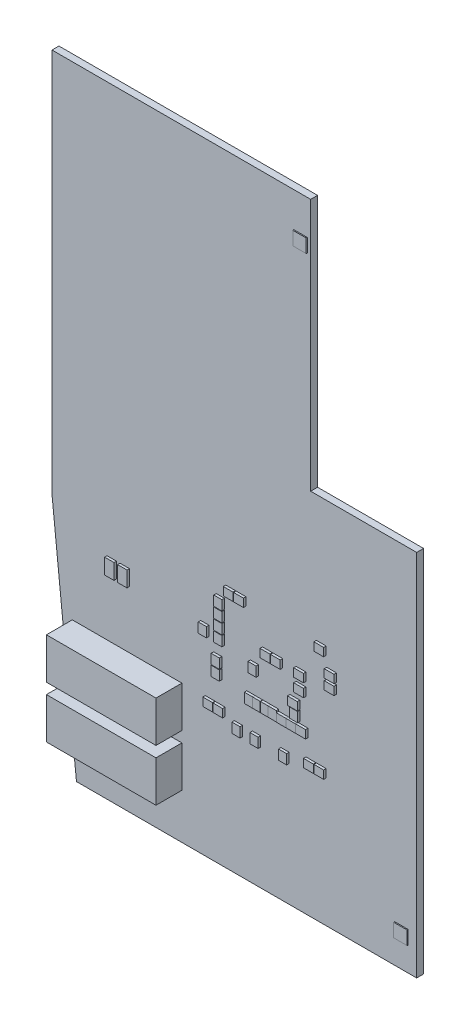
from build123d import *

# Parameters (mm, degrees)
BOARD_DEPTH                   = 1.697736
SKETCH2_W                     = 27.999944
SKETCH2_H                     = 27.999944
PBGA_324P_1MM_1_DEPTH         = 2.549906
SKETCH5_W                     = 7.20344
SKETCH5_H                     = 10.203434
SOT_223_1_DEPTH               = 1.778
SKETCH8_W                     = 12.003278
SKETCH8_H                     = 11.703304
HTSSOP_32P_0_65_1_DEPTH       = 2.649982
SKETCH53_W                    = 8.203184
SKETCH53_H                    = 5.803138
TSSOP_14P_0_65_1_DEPTH        = 1.100074
SKETCH54_W                    = 8.203184
SKETCH54_H                    = 5.803138
TSSOP_14P_0_65_2_DEPTH        = 1.100074
SKETCH57_W                    = 11.699748
SKETCH57_H                    = 9.699752
BGA_48P_0_8_1_DEPTH           = 0.999998
SKETCH58_W                    = 11.699748
SKETCH58_H                    = 9.699752
FBGA_48P_0_75_S_1_DEPTH       = 1.199896
SKETCH59_W                    = 13.700252
SKETCH59_H                    = 13.700252
FBGA_48P_0_75_1_DEPTH         = 1.35001
SKETCH60_W                    = 13.999972
SKETCH60_H                    = 13.999972
TFBGA_128P_0_8_1_DEPTH        = 1.199896
SKETCH62_W                    = 5.84327
SKETCH62_H                    = 8.279384
SO8_1_DEPTH                   = 1.75006
SKETCH66_W                    = 15.003272
SKETCH66_H                    = 14.203172
TQFP_44P_0_8_1_DEPTH          = 1.199896
SKETCH68_W                    = 5.84327
SKETCH68_H                    = 8.279384
SO8_2_DEPTH                   = 1.75006
SKETCH79_W                    = 13.999972
SKETCH79_H                    = 13.999972
TFBGA_128P_0_8_2_DEPTH        = 1.199896
SKETCH106_W                   = 8.279384
SKETCH106_H                   = 5.84327
SO8_3_DEPTH                   = 1.75006
SKETCH140_W                   = 3.854196
SKETCH140_H                   = 8.970264
TSSOP_8P_0_65_1_DEPTH         = 1.199896
SKETCH150_W                   = 7.403338
SKETCH150_H                   = 8.453374
TSSOP_20_0_65_1_DEPTH         = 1.199896
SKETCH151_W                   = 3.70332
SKETCH151_H                   = 6.703314
MSOP_10P_0_5_1_DEPTH          = 1.100074
SKETCH164_W                   = 42.203116
SKETCH164_H                   = 9.003284
CON_80P_0_8MM_QSE_SOC_1_DEPTH = 3.048
SKETCH165_W                   = 42.203116
SKETCH165_H                   = 9.003284
CON_80P_0_8MM_QSE_SOC_2_DEPTH = 3.048
CON_10P_100_RA_1_DEPTH        = 4.826
SKETCH171_W                   = 14.1732
SKETCH171_H                   = 19.8882
CON_14P_100_RA_1_DEPTH        = 4.826
SKETCH172_W                   = 14.203172
SKETCH172_H                   = 7.703312
DPAK_1_DEPTH                  = 2.54
SKETCH173_W                   = 7.703312
SKETCH173_H                   = 14.203172
DPAK_2_DEPTH                  = 2.54
SKETCH174_W                   = 6.453378
SKETCH174_H                   = 3.753358
MSOP_8P_0_65_1_DEPTH          = 1.100074
SKETCH175_W                   = 6.453378
SKETCH175_H                   = 3.753358
MSOP_8P_0_65_2_DEPTH          = 1.100074
SKETCH176_W                   = 6.453378
SKETCH176_H                   = 3.753358
MSOP_8P_0_65_3_DEPTH          = 1.100074
SKETCH177_W                   = 6.453378
SKETCH177_H                   = 3.753358
MSOP_8P_0_65_4_DEPTH          = 1.100074
SKETCH179_W                   = 8.279384
SKETCH179_H                   = 5.84327
SO8_4_DEPTH                   = 1.75006
SKETCH180_W                   = 2.303272
SKETCH180_H                   = 3.803396
SOT_553_5P_1_DEPTH            = 0.599948
SKETCH181_W                   = 2.303272
SKETCH181_H                   = 3.803396
SOT_553_5P_2_DEPTH            = 0.599948
SKETCH192_W                   = 4.903216
SKETCH192_H                   = 3.05308
RP_0402_16P_1_DEPTH           = 0.54991
SKETCH193_W                   = 4.903216
SKETCH193_H                   = 3.05308
RP_0402_16P_2_DEPTH           = 0.54991
SKETCH194_W                   = 3.05308
SKETCH194_H                   = 4.903216
RP_0402_16P_3_DEPTH           = 0.54991
SKETCH195_W                   = 3.05308
SKETCH195_H                   = 4.903216
RP_0402_16P_4_DEPTH           = 0.54991
SKETCH196_W                   = 3.05308
SKETCH196_H                   = 4.903216
RP_0402_16P_5_DEPTH           = 0.54991
SKETCH200_W                   = 7.403338
SKETCH200_H                   = 8.453374
TSSOP_20_0_65_2_DEPTH         = 1.199896
SKETCH201_W                   = 7.403338
SKETCH201_H                   = 8.453374
TSSOP_20_0_65_3_DEPTH         = 1.199896
SKETCH202_W                   = 7.403338
SKETCH202_H                   = 8.453374
TSSOP_20_0_65_4_DEPTH         = 1.199896
SKETCH203_W                   = 7.403338
SKETCH203_H                   = 8.453374
TSSOP_20_0_65_5_DEPTH         = 1.199896
SKETCH333_W                   = 2.003044
SKETCH333_H                   = 2.403348
EXTRUDE_C0306_1_DEPTH         = 0.610108
SKETCH334_W                   = 2.403348
SKETCH334_H                   = 2.003044
EXTRUDE_C0306_2_DEPTH         = 0.610108
SKETCH335_W                   = 2.403348
SKETCH335_H                   = 2.003044
EXTRUDE_C0306_3_DEPTH         = 0.610108
SKETCH336_W                   = 2.003044
SKETCH336_H                   = 2.403348
EXTRUDE_C0306_4_DEPTH         = 0.610108
SKETCH337_W                   = 2.003044
SKETCH337_H                   = 2.403348
EXTRUDE_C0306_5_DEPTH         = 0.610108
SKETCH338_W                   = 2.003044
SKETCH338_H                   = 2.403348
EXTRUDE_C0306_6_DEPTH         = 0.610108
SKETCH339_W                   = 2.003044
SKETCH339_H                   = 2.403348
EXTRUDE_C0306_7_DEPTH         = 0.610108
SKETCH340_W                   = 2.403348
SKETCH340_H                   = 2.003044
EXTRUDE_C0306_8_DEPTH         = 0.610108
SKETCH341_W                   = 2.403348
SKETCH341_H                   = 2.003044
EXTRUDE_C0306_9_DEPTH         = 0.610108
SKETCH342_W                   = 2.403348
SKETCH342_H                   = 2.003044
EXTRUDE_C0306_10_DEPTH        = 0.610108
SKETCH343_W                   = 2.003044
SKETCH343_H                   = 2.403348
EXTRUDE_C0306_11_DEPTH        = 0.610108
SKETCH344_W                   = 2.003044
SKETCH344_H                   = 2.403348
EXTRUDE_C0306_12_DEPTH        = 0.610108
SKETCH345_W                   = 2.403348
SKETCH345_H                   = 2.003044
EXTRUDE_C0306_13_DEPTH        = 0.610108
SKETCH346_W                   = 2.003044
SKETCH346_H                   = 2.403348
EXTRUDE_C0306_14_DEPTH        = 0.610108
SKETCH347_W                   = 2.003044
SKETCH347_H                   = 2.403348
EXTRUDE_C0306_15_DEPTH        = 0.610108
SKETCH348_W                   = 2.003044
SKETCH348_H                   = 2.403348
EXTRUDE_C0306_16_DEPTH        = 0.610108
SKETCH349_W                   = 2.403348
SKETCH349_H                   = 2.003044
EXTRUDE_C0306_17_DEPTH        = 0.610108
SKETCH350_W                   = 2.403348
SKETCH350_H                   = 2.003044
EXTRUDE_C0306_18_DEPTH        = 0.610108
SKETCH351_W                   = 2.403348
SKETCH351_H                   = 2.003044
EXTRUDE_C0306_19_DEPTH        = 0.610108
SKETCH352_W                   = 2.003044
SKETCH352_H                   = 2.403348
EXTRUDE_C0306_20_DEPTH        = 0.610108
SKETCH353_W                   = 2.403348
SKETCH353_H                   = 2.003044
EXTRUDE_C0306_21_DEPTH        = 0.610108
SKETCH354_W                   = 2.003044
SKETCH354_H                   = 2.403348
EXTRUDE_C0306_22_DEPTH        = 0.610108
SKETCH355_W                   = 2.403348
SKETCH355_H                   = 2.003044
EXTRUDE_C0306_23_DEPTH        = 0.610108
SKETCH356_W                   = 2.403348
SKETCH356_H                   = 2.003044
EXTRUDE_C0306_24_DEPTH        = 0.610108
SKETCH357_W                   = 2.403348
SKETCH357_H                   = 2.003044
EXTRUDE_C0306_25_DEPTH        = 0.610108
SKETCH358_W                   = 2.403348
SKETCH358_H                   = 2.003044
EXTRUDE_C0306_26_DEPTH        = 0.610108
SKETCH359_W                   = 2.403348
SKETCH359_H                   = 2.003044
EXTRUDE_C0306_27_DEPTH        = 0.610108
SKETCH360_W                   = 2.403348
SKETCH360_H                   = 2.003044
EXTRUDE_C0306_28_DEPTH        = 0.610108
SKETCH361_W                   = 2.403348
SKETCH361_H                   = 2.003044
EXTRUDE_C0306_29_DEPTH        = 0.610108
SKETCH362_W                   = 2.003044
SKETCH362_H                   = 2.403348
EXTRUDE_C0306_30_DEPTH        = 0.610108
SKETCH363_W                   = 2.003044
SKETCH363_H                   = 2.403348
EXTRUDE_C0306_31_DEPTH        = 0.610108
SKETCH364_W                   = 2.003044
SKETCH364_H                   = 2.403348
EXTRUDE_C0306_32_DEPTH        = 0.610108
SKETCH365_W                   = 2.003044
SKETCH365_H                   = 2.403348
EXTRUDE_C0306_33_DEPTH        = 0.610108
SKETCH407_W                   = 8.279384
SKETCH407_H                   = 5.84327
SO8_5_DEPTH                   = 1.75006
CON_6P_100_RA_1_DEPTH         = 4.1148
SKETCH419_W                   = 26.8732
SKETCH419_H                   = 10.0711
CON_38P_25_TE_1_DEPTH         = 6.35
SKETCH420_W                   = 26.8732
SKETCH420_H                   = 10.0711
CON_38P_25_TE_2_DEPTH         = 6.35
SKETCH443_W                   = 3.302
SKETCH443_H                   = 3.302
FIDUCIAL_1_DEPTH              = 0.254
SKETCH444_W                   = 3.302
SKETCH444_H                   = 3.302
FIDUCIAL_2_DEPTH              = 0.254
SKETCH445_W                   = 3.302
SKETCH445_H                   = 3.302
FIDUCIAL_3_DEPTH              = 0.254
SKETCH446_W                   = 3.302
SKETCH446_H                   = 3.302
FIDUCIAL_4_DEPTH              = 0.254
SKETCH447_W                   = 3.302
SKETCH447_H                   = 3.302
FIDUCIAL_5_DEPTH              = 0.254
SKETCH448_W                   = 3.302
SKETCH448_H                   = 3.302
FIDUCIAL_6_DEPTH              = 0.254


with BuildPart() as part:
    # Sketch1 → BOARD (new body)
    with BuildSketch(Plane.XY):
        Polygon((0, 152.4), (0, 57.999884), (5.999988, 0), (89.440004, 0), (89.440004, 90.400124), (63.440056, 90.400124), (63.440056, 152.4), align=None)
    extrude(amount=BOARD_DEPTH)


with BuildPart() as body_2:
    # Sketch2 → PBGA_324P_1MM-1 (new body)
    with BuildSketch(Plane.XY):
        with Locations((54.99989, 44.99991)):
            Rectangle(SKETCH2_W, SKETCH2_H)
    extrude(amount=-PBGA_324P_1MM_1_DEPTH)


with BuildPart() as body_3:
    # Sketch5 → SOT-223-1 (new body)
    with BuildSketch(Plane.XY):
        with Locations((78.74, 69.731001)):
            Rectangle(SKETCH5_W, SKETCH5_H)
    extrude(amount=-SOT_223_1_DEPTH)


with BuildPart() as body_4:
    # Sketch8 → HTSSOP_32P_0_65-1 (new body)
    with BuildSketch(Plane.XY):
        with Locations((38.100127, 131.500118)):
            Rectangle(SKETCH8_W, SKETCH8_H)
    extrude(amount=-HTSSOP_32P_0_65_1_DEPTH)


with BuildPart() as body_5:
    # Sketch53 → TSSOP_14P_0_65-1 (new body)
    with BuildSketch(Plane.XY):
        with Locations((29.595064, 38.050089)):
            Rectangle(SKETCH53_W, SKETCH53_H)
    extrude(amount=-TSSOP_14P_0_65_1_DEPTH)


with BuildPart() as body_6:
    # Sketch54 → TSSOP_14P_0_65-2 (new body)
    with BuildSketch(Plane.XY):
        with Locations((29.595064, 27.255089)):
            Rectangle(SKETCH54_W, SKETCH54_H)
    extrude(amount=-TSSOP_14P_0_65_2_DEPTH)


with BuildPart() as body_7:
    # Sketch57 → BGA_48P_0_8-1 (new body)
    with BuildSketch(Plane.XY):
        with Locations((81.000092, 17.999964)):
            Rectangle(SKETCH57_W, SKETCH57_H)
    extrude(amount=-BGA_48P_0_8_1_DEPTH)


with BuildPart() as body_8:
    # Sketch58 → FBGA_48P_0_75_S-1 (new body)
    with BuildSketch(Plane.XY):
        with Locations((81.000092, 44.99991)):
            Rectangle(SKETCH58_W, SKETCH58_H)
    extrude(amount=-FBGA_48P_0_75_S_1_DEPTH)


with BuildPart() as body_9:
    # Sketch59 → FBGA_48P_0_75-1 (new body)
    with BuildSketch(Plane.XY):
        with Locations((81.000092, 31.999936)):
            Rectangle(SKETCH59_W, SKETCH59_H)
    extrude(amount=-FBGA_48P_0_75_1_DEPTH)


with BuildPart() as body_10:
    # Sketch60 → TFBGA_128P_0_8-1 (new body)
    with BuildSketch(Plane.XY):
        with Locations((28.999942, 77.0001)):
            Rectangle(SKETCH60_W, SKETCH60_H)
    extrude(amount=-TFBGA_128P_0_8_1_DEPTH)


with BuildPart() as body_11:
    # Sketch62 → SO8-1 (new body)
    with BuildSketch(Plane.XY):
        with Locations((5.995035, 93.497908)):
            Rectangle(SKETCH62_W, SKETCH62_H)
    extrude(amount=-SO8_1_DEPTH)


with BuildPart() as body_12:
    # Sketch66 → TQFP_44P_0_8-1 (new body)
    with BuildSketch(Plane.XY):
        with Locations((24.53005, 56.515)):
            Rectangle(SKETCH66_W, SKETCH66_H)
    extrude(amount=-TQFP_44P_0_8_1_DEPTH)


with BuildPart() as body_13:
    # Sketch68 → SO8-2 (new body)
    with BuildSketch(Plane.XY):
        with Locations((56.869965, 94.462092)):
            Rectangle(SKETCH68_W, SKETCH68_H)
    extrude(amount=-SO8_2_DEPTH)


with BuildPart() as body_14:
    # Sketch79 → TFBGA_128P_0_8-2 (new body)
    with BuildSketch(Plane.XY):
        with Locations((50.999898, 77.0001)):
            Rectangle(SKETCH79_W, SKETCH79_H)
    extrude(amount=-TFBGA_128P_0_8_2_DEPTH)


with BuildPart() as body_15:
    # Sketch106 → SO8-3 (new body)
    with BuildSketch(Plane.XY):
        with Locations((33.982152, 108.779945)):
            Rectangle(SKETCH106_W, SKETCH106_H)
    extrude(amount=-SO8_3_DEPTH)


with BuildPart() as body_16:
    # Sketch140 → TSSOP_8P_0_65-1 (new body)
    with BuildSketch(Plane.XY):
        with Locations((34.059876, 53.05679)):
            Rectangle(SKETCH140_W, SKETCH140_H)
    extrude(amount=-TSSOP_8P_0_65_1_DEPTH)


with BuildPart() as body_17:
    # Sketch150 → TSSOP_20_0_65-1 (new body)
    with BuildSketch(Plane.XY):
        with Locations((70.385051, 8.630031)):
            Rectangle(SKETCH150_W, SKETCH150_H)
    extrude(amount=-TSSOP_20_0_65_1_DEPTH)


with BuildPart() as body_18:
    # Sketch151 → MSOP_10P_0_5-1 (new body)
    with BuildSketch(Plane.XY):
        with Locations((27.305, 16.259937)):
            Rectangle(SKETCH151_W, SKETCH151_H)
    extrude(amount=-MSOP_10P_0_5_1_DEPTH)


with BuildPart() as body_19:
    # Sketch164 → CON_80P_0_8MM_QSE_SOC-1 (new body)
    with BuildSketch(Plane.XY):
        with Locations((31.640018, 94.819978)):
            Rectangle(SKETCH164_W, SKETCH164_H)
    extrude(amount=-CON_80P_0_8MM_QSE_SOC_1_DEPTH)


with BuildPart() as body_20:
    # Sketch165 → CON_80P_0_8MM_QSE_SOC-2 (new body)
    with BuildSketch(Plane.XY):
        with Locations((43.720004, 6.700012)):
            Rectangle(SKETCH165_W, SKETCH165_H)
    extrude(amount=-CON_80P_0_8MM_QSE_SOC_2_DEPTH)


with BuildPart() as body_21:
    # Sketch170 → CON_10P_100_RA-1 (new body)
    with BuildSketch(Plane.XY):
        Polygon((0.698370082, 51.257474946), (-0.290302372, 65.396149743), (13.848372426, 66.384822197), (14.837044879, 52.246147399), align=None)
    extrude(amount=-CON_10P_100_RA_1_DEPTH)


with BuildPart() as body_22:
    # Sketch171 → CON_14P_100_RA-1 (new body)
    with BuildSketch(Plane.XY):
        with Locations((6.985, 77.7875)):
            Rectangle(SKETCH171_W, SKETCH171_H)
    extrude(amount=-CON_14P_100_RA_1_DEPTH)


with BuildPart() as body_23:
    # Sketch172 → DPAK-1 (new body)
    with BuildSketch(Plane.XY):
        with Locations((43.749976, 120.000014)):
            Rectangle(SKETCH172_W, SKETCH172_H)
    extrude(amount=-DPAK_1_DEPTH)


with BuildPart() as body_24:
    # Sketch173 → DPAK-2 (new body)
    with BuildSketch(Plane.XY):
        with Locations((21.500084, 133.75005)):
            Rectangle(SKETCH173_W, SKETCH173_H)
    extrude(amount=-DPAK_2_DEPTH)


with BuildPart() as body_25:
    # Sketch174 → MSOP_8P_0_65-1 (new body)
    with BuildSketch(Plane.XY):
        with Locations((82.874993, 80.035019)):
            Rectangle(SKETCH174_W, SKETCH174_H)
    extrude(amount=-MSOP_8P_0_65_1_DEPTH)


with BuildPart() as body_26:
    # Sketch175 → MSOP_8P_0_65-2 (new body)
    with BuildSketch(Plane.XY):
        with Locations((82.874993, 85.115019)):
            Rectangle(SKETCH175_W, SKETCH175_H)
    extrude(amount=-MSOP_8P_0_65_2_DEPTH)


with BuildPart() as body_27:
    # Sketch176 → MSOP_8P_0_65-3 (new body)
    with BuildSketch(Plane.XY):
        with Locations((71.444993, 80.035019)):
            Rectangle(SKETCH176_W, SKETCH176_H)
    extrude(amount=-MSOP_8P_0_65_3_DEPTH)


with BuildPart() as body_28:
    # Sketch177 → MSOP_8P_0_65-4 (new body)
    with BuildSketch(Plane.XY):
        with Locations((71.444993, 85.115019)):
            Rectangle(SKETCH177_W, SKETCH177_H)
    extrude(amount=-MSOP_8P_0_65_4_DEPTH)


with BuildPart() as body_29:
    # Sketch179 → SO8-4 (new body)
    with BuildSketch(Plane.XY):
        with Locations((4.977892, 135.449945)):
            Rectangle(SKETCH179_W, SKETCH179_H)
    extrude(amount=-SO8_4_DEPTH)


with BuildPart() as body_30:
    # Sketch180 → SOT_553_5P-1 (new body)
    with BuildSketch(Plane.XY.offset(1.697736)):
        with Locations((14.655038, 49.829974)):
            Rectangle(SKETCH180_W, SKETCH180_H)
    extrude(amount=SOT_553_5P_1_DEPTH)


with BuildPart() as body_31:
    # Sketch181 → SOT_553_5P-2 (new body)
    with BuildSketch(Plane.XY.offset(1.697736)):
        with Locations((17.830038, 49.829974)):
            Rectangle(SKETCH181_W, SKETCH181_H)
    extrude(amount=SOT_553_5P_2_DEPTH)


with BuildPart() as body_32:
    # Sketch192 → RP_0402_16P-1 (new body)
    with BuildSketch(Plane.XY):
        with Locations((66.675, 28.984956)):
            Rectangle(SKETCH192_W, SKETCH192_H)
    extrude(amount=-RP_0402_16P_1_DEPTH)


with BuildPart() as body_33:
    # Sketch193 → RP_0402_16P-2 (new body)
    with BuildSketch(Plane.XY):
        with Locations((61.595, 28.730956)):
            Rectangle(SKETCH193_W, SKETCH193_H)
    extrude(amount=-RP_0402_16P_2_DEPTH)


with BuildPart() as body_34:
    # Sketch194 → RP_0402_16P-3 (new body)
    with BuildSketch(Plane.XY):
        with Locations((71.980044, 42.545)):
            Rectangle(SKETCH194_W, SKETCH194_H)
    extrude(amount=-RP_0402_16P_3_DEPTH)


with BuildPart() as body_35:
    # Sketch195 → RP_0402_16P-4 (new body)
    with BuildSketch(Plane.XY):
        with Locations((71.980044, 37.465)):
            Rectangle(SKETCH195_W, SKETCH195_H)
    extrude(amount=-RP_0402_16P_4_DEPTH)


with BuildPart() as body_36:
    # Sketch196 → RP_0402_16P-5 (new body)
    with BuildSketch(Plane.XY):
        with Locations((71.980044, 47.625)):
            Rectangle(SKETCH196_W, SKETCH196_H)
    extrude(amount=-RP_0402_16P_5_DEPTH)


with BuildPart() as body_37:
    # Sketch200 → TSSOP_20_0_65-2 (new body)
    with BuildSketch(Plane.XY):
        with Locations((36.730051, 18.790031)):
            Rectangle(SKETCH200_W, SKETCH200_H)
    extrude(amount=-TSSOP_20_0_65_2_DEPTH)


with BuildPart() as body_38:
    # Sketch201 → TSSOP_20_0_65-3 (new body)
    with BuildSketch(Plane.XY):
        with Locations((53.240051, 18.790031)):
            Rectangle(SKETCH201_W, SKETCH201_H)
    extrude(amount=-TSSOP_20_0_65_3_DEPTH)


with BuildPart() as body_39:
    # Sketch202 → TSSOP_20_0_65-4 (new body)
    with BuildSketch(Plane.XY):
        with Locations((44.985051, 18.790031)):
            Rectangle(SKETCH202_W, SKETCH202_H)
    extrude(amount=-TSSOP_20_0_65_4_DEPTH)


with BuildPart() as body_40:
    # Sketch203 → TSSOP_20_0_65-5 (new body)
    with BuildSketch(Plane.XY):
        with Locations((61.495051, 18.790031)):
            Rectangle(SKETCH203_W, SKETCH203_H)
    extrude(amount=-TSSOP_20_0_65_5_DEPTH)


with BuildPart() as body_41:
    # Sketch333 → C0306-1 (new body)
    with BuildSketch(Plane.XY.offset(1.697736)):
        with Locations((49.657, 45.974)):
            Rectangle(SKETCH333_W, SKETCH333_H)
    extrude(amount=EXTRUDE_C0306_1_DEPTH)


with BuildPart() as body_42:
    # Sketch334 → C0306-2 (new body)
    with BuildSketch(Plane.XY.offset(1.697736)):
        with Locations((68.58, 51.435)):
            Rectangle(SKETCH334_W, SKETCH334_H)
    extrude(amount=EXTRUDE_C0306_2_DEPTH)


with BuildPart() as body_43:
    # Sketch335 → C0306-3 (new body)
    with BuildSketch(Plane.XY.offset(1.697736)):
        with Locations((59.563, 43.688)):
            Rectangle(SKETCH335_W, SKETCH335_H)
    extrude(amount=EXTRUDE_C0306_3_DEPTH)


with BuildPart() as body_44:
    # Sketch336 → C0306-4 (new body)
    with BuildSketch(Plane.XY.offset(1.697736)):
        with Locations((54.61, 38.989)):
            Rectangle(SKETCH336_W, SKETCH336_H)
    extrude(amount=EXTRUDE_C0306_4_DEPTH)


with BuildPart() as body_45:
    # Sketch337 → C0306-5 (new body)
    with BuildSketch(Plane.XY.offset(1.697736)):
        with Locations((50.673, 38.989)):
            Rectangle(SKETCH337_W, SKETCH337_H)
    extrude(amount=EXTRUDE_C0306_5_DEPTH)


with BuildPart() as body_46:
    # Sketch338 → C0306-6 (new body)
    with BuildSketch(Plane.XY.offset(1.697736)):
        with Locations((48.768, 38.989)):
            Rectangle(SKETCH338_W, SKETCH338_H)
    extrude(amount=EXTRUDE_C0306_6_DEPTH)


with BuildPart() as body_47:
    # Sketch339 → C0306-7 (new body)
    with BuildSketch(Plane.XY.offset(1.697736)):
        with Locations((59.817, 41.402)):
            Rectangle(SKETCH339_W, SKETCH339_H)
    extrude(amount=EXTRUDE_C0306_7_DEPTH)


with BuildPart() as body_48:
    # Sketch340 → C0306-8 (new body)
    with BuildSketch(Plane.XY.offset(1.697736)):
        with Locations((59.182, 38.735)):
            Rectangle(SKETCH340_W, SKETCH340_H)
    extrude(amount=EXTRUDE_C0306_8_DEPTH)


with BuildPart() as body_49:
    # Sketch341 → C0306-9 (new body)
    with BuildSketch(Plane.XY.offset(1.697736)):
        with Locations((56.769, 38.735)):
            Rectangle(SKETCH341_W, SKETCH341_H)
    extrude(amount=EXTRUDE_C0306_9_DEPTH)


with BuildPart() as body_50:
    # Sketch342 → C0306-10 (new body)
    with BuildSketch(Plane.XY.offset(1.697736)):
        with Locations((43.815, 59.055)):
            Rectangle(SKETCH342_W, SKETCH342_H)
    extrude(amount=EXTRUDE_C0306_10_DEPTH)


with BuildPart() as body_51:
    # Sketch343 → C0306-11 (new body)
    with BuildSketch(Plane.XY.offset(1.697736)):
        with Locations((41.275, 50.8)):
            Rectangle(SKETCH343_W, SKETCH343_H)
    extrude(amount=EXTRUDE_C0306_11_DEPTH)


with BuildPart() as body_52:
    # Sketch344 → C0306-12 (new body)
    with BuildSketch(Plane.XY.offset(1.697736)):
        with Locations((41.275, 55.88)):
            Rectangle(SKETCH344_W, SKETCH344_H)
    extrude(amount=EXTRUDE_C0306_12_DEPTH)


with BuildPart() as body_53:
    # Sketch345 → C0306-13 (new body)
    with BuildSketch(Plane.XY.offset(1.697736)):
        with Locations((68.58, 53.975)):
            Rectangle(SKETCH345_W, SKETCH345_H)
    extrude(amount=EXTRUDE_C0306_13_DEPTH)


with BuildPart() as body_54:
    # Sketch346 → C0306-14 (new body)
    with BuildSketch(Plane.XY.offset(1.697736)):
        with Locations((57.15, 31.115)):
            Rectangle(SKETCH346_W, SKETCH346_H)
    extrude(amount=EXTRUDE_C0306_14_DEPTH)


with BuildPart() as body_55:
    # Sketch347 → C0306-15 (new body)
    with BuildSketch(Plane.XY.offset(1.697736)):
        with Locations((40.64, 40.64)):
            Rectangle(SKETCH347_W, SKETCH347_H)
    extrude(amount=EXTRUDE_C0306_15_DEPTH)


with BuildPart() as body_56:
    # Sketch348 → C0306-16 (new body)
    with BuildSketch(Plane.XY.offset(1.697736)):
        with Locations((45.72, 31.115)):
            Rectangle(SKETCH348_W, SKETCH348_H)
    extrude(amount=EXTRUDE_C0306_16_DEPTH)


with BuildPart() as body_57:
    # Sketch349 → C0306-17 (new body)
    with BuildSketch(Plane.XY.offset(1.697736)):
        with Locations((63.5, 32.385)):
            Rectangle(SKETCH349_W, SKETCH349_H)
    extrude(amount=EXTRUDE_C0306_17_DEPTH)


with BuildPart() as body_58:
    # Sketch350 → C0306-18 (new body)
    with BuildSketch(Plane.XY.offset(1.697736)):
        with Locations((52.832, 50.419)):
            Rectangle(SKETCH350_W, SKETCH350_H)
    extrude(amount=EXTRUDE_C0306_18_DEPTH)


with BuildPart() as body_59:
    # Sketch351 → C0306-19 (new body)
    with BuildSketch(Plane.XY.offset(1.697736)):
        with Locations((55.372, 50.419)):
            Rectangle(SKETCH351_W, SKETCH351_H)
    extrude(amount=EXTRUDE_C0306_19_DEPTH)


with BuildPart() as body_60:
    # Sketch352 → C0306-20 (new body)
    with BuildSketch(Plane.XY.offset(1.697736)):
        with Locations((37.465, 48.26)):
            Rectangle(SKETCH352_W, SKETCH352_H)
    extrude(amount=EXTRUDE_C0306_20_DEPTH)


with BuildPart() as body_61:
    # Sketch353 → C0306-21 (new body)
    with BuildSketch(Plane.XY.offset(1.697736)):
        with Locations((66.04, 58.42)):
            Rectangle(SKETCH353_W, SKETCH353_H)
    extrude(amount=EXTRUDE_C0306_21_DEPTH)


with BuildPart() as body_62:
    # Sketch354 → C0306-22 (new body)
    with BuildSketch(Plane.XY.offset(1.697736)):
        with Locations((41.275, 53.34)):
            Rectangle(SKETCH354_W, SKETCH354_H)
    extrude(amount=EXTRUDE_C0306_22_DEPTH)


with BuildPart() as body_63:
    # Sketch355 → C0306-23 (new body)
    with BuildSketch(Plane.XY.offset(1.697736)):
        with Locations((46.355, 59.055)):
            Rectangle(SKETCH355_W, SKETCH355_H)
    extrude(amount=EXTRUDE_C0306_23_DEPTH)


with BuildPart() as body_64:
    # Sketch356 → C0306-24 (new body)
    with BuildSketch(Plane.XY.offset(1.697736)):
        with Locations((61.087, 50.419)):
            Rectangle(SKETCH356_W, SKETCH356_H)
    extrude(amount=EXTRUDE_C0306_24_DEPTH)


with BuildPart() as body_65:
    # Sketch357 → C0306-25 (new body)
    with BuildSketch(Plane.XY.offset(1.697736)):
        with Locations((38.7858, 33.0708)):
            Rectangle(SKETCH357_W, SKETCH357_H)
    extrude(amount=EXTRUDE_C0306_25_DEPTH)


with BuildPart() as body_66:
    # Sketch358 → C0306-26 (new body)
    with BuildSketch(Plane.XY.offset(1.697736)):
        with Locations((41.2496, 33.0454)):
            Rectangle(SKETCH358_W, SKETCH358_H)
    extrude(amount=EXTRUDE_C0306_26_DEPTH)


with BuildPart() as body_67:
    # Sketch359 → C0306-27 (new body)
    with BuildSketch(Plane.XY.offset(1.697736)):
        with Locations((66.04, 32.385)):
            Rectangle(SKETCH359_W, SKETCH359_H)
    extrude(amount=EXTRUDE_C0306_27_DEPTH)


with BuildPart() as body_68:
    # Sketch360 → C0306-28 (new body)
    with BuildSketch(Plane.XY.offset(1.697736)):
        with Locations((61.595, 38.735)):
            Rectangle(SKETCH360_W, SKETCH360_H)
    extrude(amount=EXTRUDE_C0306_28_DEPTH)


with BuildPart() as body_69:
    # Sketch361 → C0306-29 (new body)
    with BuildSketch(Plane.XY.offset(1.697736)):
        with Locations((61.087, 47.244)):
            Rectangle(SKETCH361_W, SKETCH361_H)
    extrude(amount=EXTRUDE_C0306_29_DEPTH)


with BuildPart() as body_70:
    # Sketch362 → C0306-30 (new body)
    with BuildSketch(Plane.XY.offset(1.697736)):
        with Locations((40.64, 43.18)):
            Rectangle(SKETCH362_W, SKETCH362_H)
    extrude(amount=EXTRUDE_C0306_30_DEPTH)


with BuildPart() as body_71:
    # Sketch363 → C0306-31 (new body)
    with BuildSketch(Plane.XY.offset(1.697736)):
        with Locations((50.165, 31.115)):
            Rectangle(SKETCH363_W, SKETCH363_H)
    extrude(amount=EXTRUDE_C0306_31_DEPTH)


with BuildPart() as body_72:
    # Sketch364 → C0306-32 (new body)
    with BuildSketch(Plane.XY.offset(1.697736)):
        with Locations((52.705, 38.989)):
            Rectangle(SKETCH364_W, SKETCH364_H)
    extrude(amount=EXTRUDE_C0306_32_DEPTH)


with BuildPart() as body_73:
    # Sketch365 → C0306-33 (new body)
    with BuildSketch(Plane.XY.offset(1.697736)):
        with Locations((41.275, 48.26)):
            Rectangle(SKETCH365_W, SKETCH365_H)
    extrude(amount=EXTRUDE_C0306_33_DEPTH)


with BuildPart() as body_74:
    # Sketch407 → SO8-5 (new body)
    with BuildSketch(Plane.XY):
        with Locations((18.897092, 44.730035)):
            Rectangle(SKETCH407_W, SKETCH407_H)
    extrude(amount=-SO8_5_DEPTH)


with BuildPart() as body_75:
    # Sketch418 → CON_6P_100_RA-1 (new body)
    with BuildSketch(Plane.XY):
        Polygon((2.634506762, 33.824660064), (1.020252798, 49.183260598), (13.852767719, 50.532012266), (15.467021683, 35.173411731), align=None)
    extrude(amount=-CON_6P_100_RA_1_DEPTH)


with BuildPart() as body_76:
    # Sketch419 → CON_38P_25_TE-1 (new body)
    with BuildSketch(Plane.XY.offset(1.697736)):
        with Locations((18.415, 28.80995)):
            Rectangle(SKETCH419_W, SKETCH419_H)
    extrude(amount=CON_38P_25_TE_1_DEPTH)


with BuildPart() as body_77:
    # Sketch420 → CON_38P_25_TE-2 (new body)
    with BuildSketch(Plane.XY.offset(1.697736)):
        with Locations((18.415, 16.10995)):
            Rectangle(SKETCH420_W, SKETCH420_H)
    extrude(amount=CON_38P_25_TE_2_DEPTH)


with BuildPart() as body_78:
    # Sketch443 → FIDUCIAL-1 (new body)
    with BuildSketch(Plane.XY.offset(1.697736)):
        with Locations((6.35, 22.86)):
            Rectangle(SKETCH443_W, SKETCH443_H)
    extrude(amount=FIDUCIAL_1_DEPTH)


with BuildPart() as body_79:
    # Sketch444 → FIDUCIAL-2 (new body)
    with BuildSketch(Plane.XY):
        with Locations((6.35, 22.86)):
            Rectangle(SKETCH444_W, SKETCH444_H)
    extrude(amount=-FIDUCIAL_2_DEPTH)


with BuildPart() as body_80:
    # Sketch445 → FIDUCIAL-3 (new body)
    with BuildSketch(Plane.XY.offset(1.697736)):
        with Locations((85.725, 7.62)):
            Rectangle(SKETCH445_W, SKETCH445_H)
    extrude(amount=FIDUCIAL_3_DEPTH)


with BuildPart() as body_81:
    # Sketch446 → FIDUCIAL-4 (new body)
    with BuildSketch(Plane.XY):
        with Locations((85.725, 7.62)):
            Rectangle(SKETCH446_W, SKETCH446_H)
    extrude(amount=-FIDUCIAL_4_DEPTH)


with BuildPart() as body_82:
    # Sketch447 → FIDUCIAL-5 (new body)
    with BuildSketch(Plane.XY.offset(1.697736)):
        with Locations((60.96, 142.24)):
            Rectangle(SKETCH447_W, SKETCH447_H)
    extrude(amount=FIDUCIAL_5_DEPTH)


with BuildPart() as body_83:
    # Sketch448 → FIDUCIAL-6 (new body)
    with BuildSketch(Plane.XY):
        with Locations((60.96, 142.24)):
            Rectangle(SKETCH448_W, SKETCH448_H)
    extrude(amount=-FIDUCIAL_6_DEPTH)


solid = Compound([part.part, body_2.part, body_3.part, body_4.part, body_5.part, body_6.part, body_7.part, body_8.part, body_9.part, body_10.part, body_11.part, body_12.part, body_13.part, body_14.part, body_15.part, body_16.part, body_17.part, body_18.part, body_19.part, body_20.part, body_21.part, body_22.part, body_23.part, body_24.part, body_25.part, body_26.part, body_27.part, body_28.part, body_29.part, body_30.part, body_31.part, body_32.part, body_33.part, body_34.part, body_35.part, body_36.part, body_37.part, body_38.part, body_39.part, body_40.part, body_41.part, body_42.part, body_43.part, body_44.part, body_45.part, body_46.part, body_47.part, body_48.part, body_49.part, body_50.part, body_51.part, body_52.part, body_53.part, body_54.part, body_55.part, body_56.part, body_57.part, body_58.part, body_59.part, body_60.part, body_61.part, body_62.part, body_63.part, body_64.part, body_65.part, body_66.part, body_67.part, body_68.part, body_69.part, body_70.part, body_71.part, body_72.part, body_73.part, body_74.part, body_75.part, body_76.part, body_77.part, body_78.part, body_79.part, body_80.part, body_81.part, body_82.part, body_83.part])
